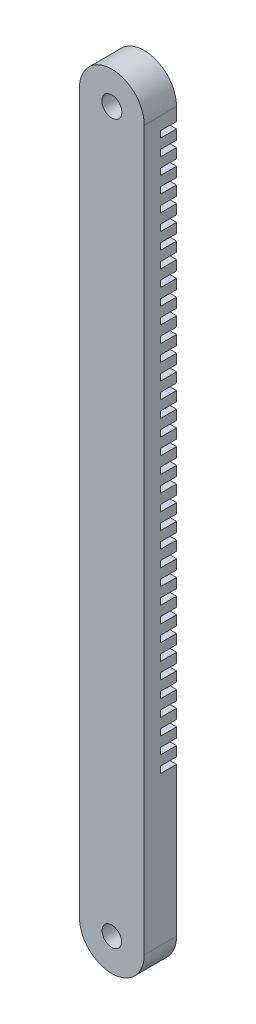
from build123d import *

# Parameters (mm, degrees)
SKETCH1_R           = 1.55
SKETCH1_R_2         = 1.5
BOSS_EXTRUDE1_DEPTH = 5
SKETCH2_W           = 2.5
SKETCH2_H           = 1
CUT_EXTRUDE1_DEPTH  = 117.537547597


with BuildPart() as part:
    # Sketch1 → Boss-Extrude1 (new body)
    with BuildSketch(Plane.XY):
        with BuildLine():
            Line((5, 0), (5, -111))
            ThreePointArc((5, -111), (0, -116), (-5, -111))
            Line((-5, -111), (-5, 0))
            ThreePointArc((-5, 0), (0, 5), (5, 0))
        make_face()
        Circle(SKETCH1_R, mode=Mode.SUBTRACT)
        with Locations((0, -111)):
            Circle(SKETCH1_R_2, mode=Mode.SUBTRACT)
    extrude(amount=BOSS_EXTRUDE1_DEPTH)

    # Sketch2 → Cut-Extrude1 (cut, through all)
    with BuildSketch(Plane(origin=(5, 0, 0), x_dir=(0, 0, -1), z_dir=(1, 0, 0))):
        with Locations((-1.25, -2.5)):
            Rectangle(SKETCH2_W, SKETCH2_H)
        with Locations((-1.25, -5)):
            Rectangle(SKETCH2_W, SKETCH2_H)
        with Locations((-1.25, -7.5)):
            Rectangle(SKETCH2_W, SKETCH2_H)
        with Locations((-1.25, -10)):
            Rectangle(SKETCH2_W, SKETCH2_H)
        with Locations((-1.25, -12.5)):
            Rectangle(SKETCH2_W, SKETCH2_H)
        with Locations((-1.25, -15)):
            Rectangle(SKETCH2_W, SKETCH2_H)
        with Locations((-1.25, -17.5)):
            Rectangle(SKETCH2_W, SKETCH2_H)
        with Locations((-1.25, -20)):
            Rectangle(SKETCH2_W, SKETCH2_H)
        with Locations((-1.25, -22.5)):
            Rectangle(SKETCH2_W, SKETCH2_H)
        with Locations((-1.25, -25)):
            Rectangle(SKETCH2_W, SKETCH2_H)
        with Locations((-1.25, -27.5)):
            Rectangle(SKETCH2_W, SKETCH2_H)
        with Locations((-1.25, -30)):
            Rectangle(SKETCH2_W, SKETCH2_H)
        with Locations((-1.25, -32.5)):
            Rectangle(SKETCH2_W, SKETCH2_H)
        with Locations((-1.25, -35)):
            Rectangle(SKETCH2_W, SKETCH2_H)
        with Locations((-1.25, -37.5)):
            Rectangle(SKETCH2_W, SKETCH2_H)
        with Locations((-1.25, -40)):
            Rectangle(SKETCH2_W, SKETCH2_H)
        with Locations((-1.25, -42.5)):
            Rectangle(SKETCH2_W, SKETCH2_H)
        with Locations((-1.25, -45)):
            Rectangle(SKETCH2_W, SKETCH2_H)
        with Locations((-1.25, -47.5)):
            Rectangle(SKETCH2_W, SKETCH2_H)
        with Locations((-1.25, -50)):
            Rectangle(SKETCH2_W, SKETCH2_H)
        with Locations((-1.25, -52.5)):
            Rectangle(SKETCH2_W, SKETCH2_H)
        with Locations((-1.25, -55)):
            Rectangle(SKETCH2_W, SKETCH2_H)
        with Locations((-1.25, -57.5)):
            Rectangle(SKETCH2_W, SKETCH2_H)
        with Locations((-1.25, -60)):
            Rectangle(SKETCH2_W, SKETCH2_H)
        with Locations((-1.25, -62.5)):
            Rectangle(SKETCH2_W, SKETCH2_H)
        with Locations((-1.25, -65)):
            Rectangle(SKETCH2_W, SKETCH2_H)
        with Locations((-1.25, -67.5)):
            Rectangle(SKETCH2_W, SKETCH2_H)
        with Locations((-1.25, -70)):
            Rectangle(SKETCH2_W, SKETCH2_H)
        with Locations((-1.25, -72.5)):
            Rectangle(SKETCH2_W, SKETCH2_H)
        with Locations((-1.25, -75)):
            Rectangle(SKETCH2_W, SKETCH2_H)
        with Locations((-1.25, -77.5)):
            Rectangle(SKETCH2_W, SKETCH2_H)
        with Locations((-1.25, -80)):
            Rectangle(SKETCH2_W, SKETCH2_H)
        with Locations((-1.25, -82.5)):
            Rectangle(SKETCH2_W, SKETCH2_H)
        with Locations((-1.25, -85)):
            Rectangle(SKETCH2_W, SKETCH2_H)
        with Locations((-1.25, -87.5)):
            Rectangle(SKETCH2_W, SKETCH2_H)
    extrude(amount=-CUT_EXTRUDE1_DEPTH, mode=Mode.SUBTRACT)


solid = part.part
